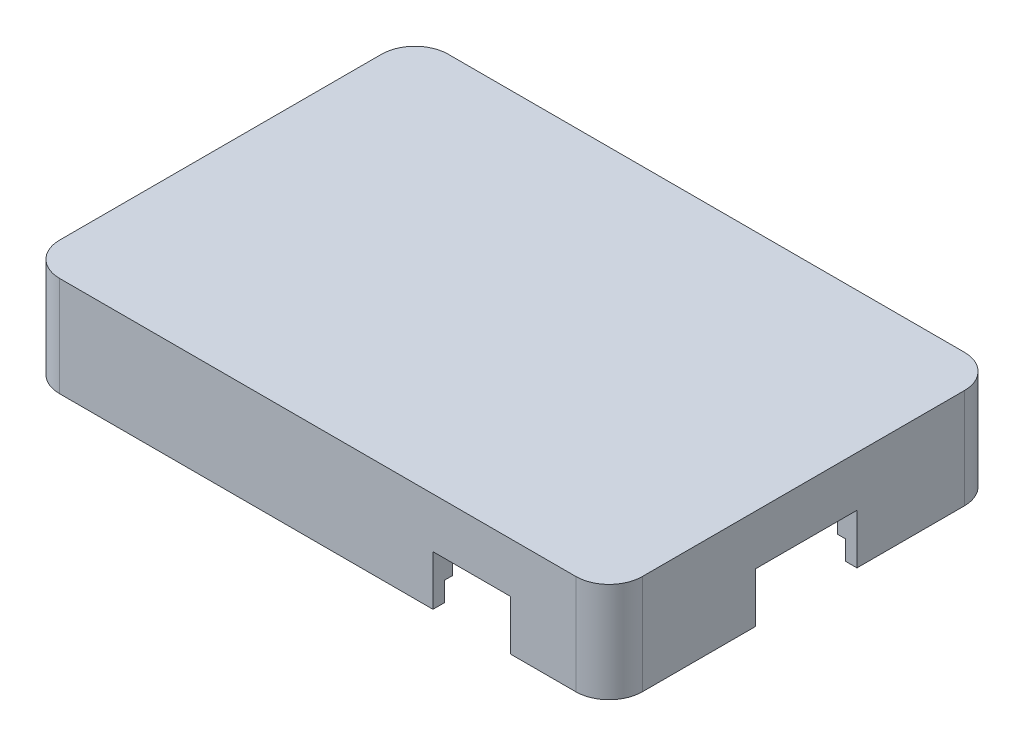
from build123d import *

# Parameters (mm, degrees)
SKETCH1_W           = 105
SKETCH1_H           = 70
BOSS_EXTRUDE1_DEPTH = 15
SKETCH3_W           = 98
SKETCH3_H           = 63
CUT_EXTRUDE1_DEPTH  = 12
FILLET1_R           = 6
SKETCH6_W           = 3.5
SKETCH6_H           = 18.3
SKETCH6_W_2         = 14
SKETCH6_H_2         = 3.5
SKETCH6_H_3         = 20
CUT_EXTRUDE3_DEPTH  = 26
CUT_EXTRUDE4_START  = -10
CUT_EXTRUDE4_DEPTH  = 10
BOSS_EXTRUDE3_DEPTH = 3
CUT_EXTRUDE5_DEPTH  = 3.5
SKETCH12_W          = 3.5
SKETCH12_H          = 18.3
SKETCH12_W_2        = 14
SKETCH12_H_2        = 3.5
SKETCH12_H_3        = 20
BOSS_EXTRUDE4_DEPTH = 6


with BuildPart() as part:
    # Sketch1 → Boss-Extrude1 (new body)
    with BuildSketch(Plane(origin=(0, 0, 0), x_dir=(1, 0, 0), z_dir=(0, 1, 0))):
        Rectangle(SKETCH1_W, SKETCH1_H)
    extrude(amount=BOSS_EXTRUDE1_DEPTH)

    # Sketch3 → Cut-Extrude1 (cut)
    with BuildSketch(Plane(origin=(0, 15, 0), x_dir=(1, 0, 0), z_dir=(0, 1, 0))):
        Rectangle(SKETCH3_W, SKETCH3_H)
    extrude(amount=-CUT_EXTRUDE1_DEPTH, mode=Mode.SUBTRACT)

    # Fillet1
    fillet1_edges = [part.edges().sort_by_distance(p)[0] for p in [
        (-52.5, 7.5, -35),
        (-52.5, 7.5, 35),
        (52.5, 7.5, -35),
        (52.5, 7.5, 35),
        (49, 9, -31.5),
        (-49, 9, -31.5),
        (-49, 9, 31.5),
        (49, 9, 31.5),
    ]]
    fillet(fillet1_edges, radius=FILLET1_R)

    # Sketch6 → Cut-Extrude3 (cut)
    with BuildSketch(Plane(origin=(0, 15, 0), x_dir=(1, 0, 0), z_dir=(0, 1, 0))):
        with Locations((50.75, 0.51)):
            Rectangle(SKETCH6_W, SKETCH6_H)
        with Locations((27.76, -33.25)):
            Rectangle(SKETCH6_W_2, SKETCH6_H_2)
        with Locations((-50.75, 0)):
            Rectangle(SKETCH6_W, SKETCH6_H_3)
    extrude(amount=-CUT_EXTRUDE3_DEPTH, mode=Mode.SUBTRACT)

    # Sketch9 → Cut-Extrude4 (cut)
    with BuildSketch(Plane(origin=(0, 3, 0), x_dir=(1, 0, 0), z_dir=(0, 1, 0)).offset(CUT_EXTRUDE4_START)):
        with BuildLine():
            Line((-43, 31.5), (43, 31.5))
            ThreePointArc((43, 31.5), (47.242640687, 29.742640687), (49, 25.5))
            Line((49, 25.5), (49, -25.5))
            ThreePointArc((49, -25.5), (47.242640687, -29.742640687), (43, -31.5))
            Line((43, -31.5), (-43, -31.5))
            ThreePointArc((-43, -31.5), (-47.242640687, -29.742640687), (-49, -25.5))
            Line((-49, -25.5), (-49, 25.5))
            ThreePointArc((-49, 25.5), (-47.242640687, 29.742640687), (-43, 31.5))
        make_face()
    extrude(amount=CUT_EXTRUDE4_DEPTH, mode=Mode.SUBTRACT)


with BuildPart() as cut_extrude4_piece_1:
    # of the separate pieces the step leaves, piece 1, a body of its own (cut_extrude4_pieces)
    add(part.part.solids().sort_by_distance((-46.5, 0, -35))[0])

    # Sketch10 → Boss-Extrude3 (add)
    with BuildSketch(Plane(origin=(0, 15, 0), x_dir=(1, 0, 0), z_dir=(0, 1, 0))):
        with BuildLine():
            Line((-46.5, 35), (46.5, 35))
            ThreePointArc((46.5, 35), (50.742640687, 33.242640687), (52.5, 29))
            Line((52.5, 29), (52.5, -29))
            ThreePointArc((52.5, -29), (50.742640687, -33.242640687), (46.5, -35))
            Line((46.5, -35), (-46.5, -35))
            ThreePointArc((-46.5, -35), (-50.742640687, -33.242640687), (-52.5, -29))
            Line((-52.5, -29), (-52.5, 29))
            ThreePointArc((-52.5, 29), (-50.742640687, 33.242640687), (-46.5, 35))
        make_face()
    extrude(amount=BOSS_EXTRUDE3_DEPTH)


with BuildPart() as cut_extrude4_piece_2:
    # of the separate pieces the step leaves, piece 2, a body of its own (cut_extrude4_pieces)
    add(part.part.solids().sort_by_distance((-52.5, 0, 10))[0])


with BuildPart() as cut_extrude4_piece_3:
    # of the separate pieces the step leaves, piece 3, a body of its own (cut_extrude4_pieces)
    add(part.part.solids().sort_by_distance((49, 0, 8.64))[0])


with BuildPart() as cut_extrude5_tool:
    # Sketch11 → Cut-Extrude5 (new body)
    with BuildSketch(Plane(origin=(0, 0, 0), x_dir=(-1, 0, 0), z_dir=(0, -1, 0))):
        with BuildLine():
            Line((-44.4, 32.9), (44.4, 32.9))
            ThreePointArc((44.4, 32.9), (48.642640687, 31.142640687), (50.4, 26.9))
            Line((50.4, 26.9), (50.4, -26.9))
            ThreePointArc((50.4, -26.9), (48.642640687, -31.142640687), (44.4, -32.9))
            Line((44.4, -32.9), (-44.4, -32.9))
            ThreePointArc((-44.4, -32.9), (-48.642640687, -31.142640687), (-50.4, -26.9))
            Line((-50.4, -26.9), (-50.4, 26.9))
            ThreePointArc((-50.4, 26.9), (-48.642640687, 31.142640687), (-44.4, 32.9))
        make_face()
    extrude(amount=-CUT_EXTRUDE5_DEPTH)


with BuildPart() as cut_extrude4_piece_1_1:
    add(cut_extrude4_piece_1.part)

    # Cut-Extrude5: cut by cut_extrude5_tool
    add(cut_extrude5_tool.part, mode=Mode.SUBTRACT)



with BuildPart() as cut_extrude4_piece_2_1:
    add(cut_extrude4_piece_2.part)

    # Cut-Extrude5: cut by cut_extrude5_tool
    add(cut_extrude5_tool.part, mode=Mode.SUBTRACT)


with BuildPart() as cut_extrude4_piece_3_1:
    add(cut_extrude4_piece_3.part)

    # Cut-Extrude5: cut by cut_extrude5_tool
    add(cut_extrude5_tool.part, mode=Mode.SUBTRACT)


with BuildPart() as cut_extrude4_piece_1_2:
    add(cut_extrude4_piece_1_1.part)

    add(cut_extrude4_piece_2_1.part)  # Boss-Extrude4 merges Cut-Extrude4 piece 2

    add(cut_extrude4_piece_3_1.part)  # Boss-Extrude4 merges Cut-Extrude4 piece 3
    # Sketch12 → Boss-Extrude4 (add)
    with BuildSketch(Plane(origin=(0, 15, 0), x_dir=(-1, 0, 0), z_dir=(0, -1, 0))):
        with Locations((-50.75, 0.51)):
            Rectangle(SKETCH12_W, SKETCH12_H)
        with Locations((-27.76, -33.25)):
            Rectangle(SKETCH12_W_2, SKETCH12_H_2)
        with Locations((50.75, 0)):
            Rectangle(SKETCH12_W, SKETCH12_H_3)
    extrude(amount=BOSS_EXTRUDE4_DEPTH)


solid = cut_extrude4_piece_1_2.part
